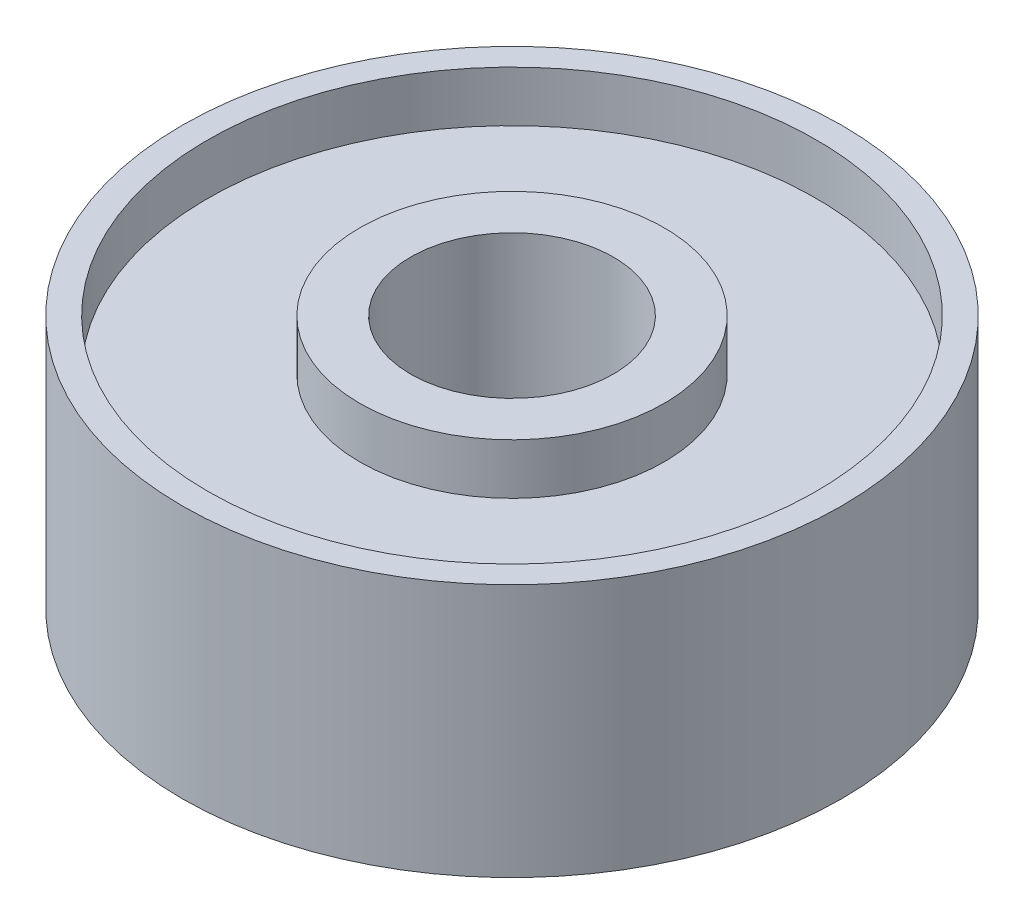
from build123d import *

# Parameters (mm, degrees)
SKETCH_1_R          = 6.5
SKETCH_1_R_2        = 2
EXTRUDE_1_DEPTH     = 5
SKETCH_2_R          = 6
SKETCH_2_R_2        = 3
CUT_EXTRUDE_1_DEPTH = 1
CUT_EXTRUDE_START   = -1
SKETCH_3_R          = 6
SKETCH_3_R_2        = 3
CUT_EXTRUDE_2_DEPTH = 1


with BuildPart() as part:
    # Эскиз1 → Бобышка-Вытянуть1 (new body)
    with BuildSketch(Plane(origin=(0, 0, 0), x_dir=(1, 0, 0), z_dir=(0, 1, 0))):
        Circle(SKETCH_1_R)
        Circle(SKETCH_1_R_2, mode=Mode.SUBTRACT)
    extrude(amount=EXTRUDE_1_DEPTH)

    # Эскиз2 → Вырез-Вытянуть1 (cut)
    with BuildSketch(Plane(origin=(0, 5, 0), x_dir=(1, 0, 0), z_dir=(0, 1, 0))):
        Circle(SKETCH_2_R)
        Circle(SKETCH_2_R_2, mode=Mode.SUBTRACT)
    extrude(amount=-CUT_EXTRUDE_1_DEPTH, mode=Mode.SUBTRACT)

    # Эскиз3 → Вырез-Вытянуть2 (cut)
    with BuildSketch(Plane.XZ.offset(CUT_EXTRUDE_START)):
        Circle(SKETCH_3_R)
        Circle(SKETCH_3_R_2, mode=Mode.SUBTRACT)
    extrude(amount=CUT_EXTRUDE_2_DEPTH, mode=Mode.SUBTRACT)


solid = part.part
